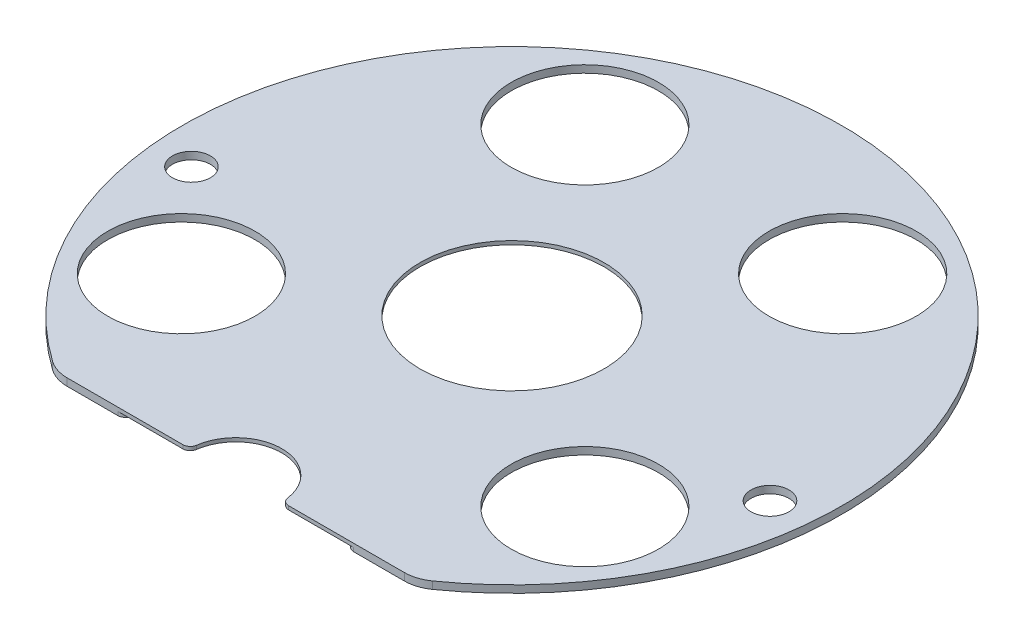
from build123d import *

# Parameters (mm, degrees)
BOSS_EXTRUDE1_DEPTH = 2
SKETCH9_R           = 5.15
CUT_EXTRUDE3_DEPTH  = 127.587914115
VISION_PATTERN_R    = 25
VISION_PATTERN_R_2  = 20
CUT_EXTRUDE4_DEPTH  = 127.587914115
FILLET1_R           = 10
BOSS_EXTRUDE4_DEPTH = 50
SKETCH12_W          = 60
SKETCH12_H          = 106
CUT_EXTRUDE5_DEPTH  = 1
SKETCH16_R          = 12.5
CUT_EXTRUDE9_DEPTH  = 20
SKETCH17_R          = 0.75
BOSS_EXTRUDE3_DEPTH = 0.425
CHAMFER1_SIZE       = 1.8
CHAMFER1_SIZE_2     = 3.860112457
CHAMFER2_SIZE       = 0.987120775
CHAMFER2_SIZE_2     = 1
FILLET3_R           = 0.1
FILLET2_R           = 0.4
FILLET4_R           = 5
FILLET5_R           = 2


with BuildPart() as part:
    # Sketch1 → Boss-Extrude1 (new body)
    with BuildSketch(Plane(origin=(0, 0, 0), x_dir=(1, 0, 0), z_dir=(0, 1, 0))):
        with BuildLine():
            Line((-48.839021284, -75), (48.839021284, -75))
            ThreePointArc((48.839021284, -75), (0, 89.5), (-48.839021284, -75))
        make_face()
    extrude(amount=-BOSS_EXTRUDE1_DEPTH)

    # Sketch9 → Cut-Extrude3 (cut, through all)
    with BuildSketch(Plane(origin=(0, 0, 0), x_dir=(1, 0, 0), z_dir=(0, 1, 0))):
        with Locations(Location((78.541209232, -8.501673503, 0), (0, 0, 270))):
            Circle(SKETCH9_R)
        with Locations(Location((-78.541209232, -8.501673503, 0), (0, 0, 270))):
            Circle(SKETCH9_R)
    extrude(amount=-CUT_EXTRUDE3_DEPTH, mode=Mode.SUBTRACT)

    # Vision Pattern → Cut-Extrude4 (cut, through all)
    with BuildSketch(Plane(origin=(0, 0, 0), x_dir=(1, 0, 0), z_dir=(0, 1, 0))):
        with Locations(Location((0, 0, 0), (0, 0, 270))):
            Circle(VISION_PATTERN_R)
        with Locations(Location((54.772255751, -35, 0), (0, 0, 270))):
            Circle(VISION_PATTERN_R_2)
        with Locations(Location((-54.772255751, -35, 0), (0, 0, 270))):
            Circle(VISION_PATTERN_R_2)
        with Locations(Location((35, 54.772255751, 0), (0, 0, 270))):
            Circle(VISION_PATTERN_R_2)
        with Locations(Location((-35, 54.772255751, 0), (0, 0, 270))):
            Circle(VISION_PATTERN_R_2)
    extrude(amount=-CUT_EXTRUDE4_DEPTH, mode=Mode.SUBTRACT)

    # Fillet1
    fillet1_edges = [part.edges().sort_by_distance(p)[0] for p in [
        (48.839021284, -1, 75),
        (-48.839021284, -1, 75),
    ]]
    fillet(fillet1_edges, radius=FILLET1_R)

    # Sketch18 → Boss-Extrude4 (add)
    with BuildSketch(Plane.XY.offset(5)):
        Polygon((62.854667939, -3.6), (67.145332061, -3.6), (66.025, -2), (63.975, -2), align=None)
    boss_extrude4 = extrude(amount=-BOSS_EXTRUDE4_DEPTH)

    # Mirror2: Boss-Extrude4 across plane
    add(boss_extrude4.mirror(Plane(origin=(0, 0, 0), x_dir=(0, 0, 1), z_dir=(1, 0, 0))))

    # Sketch12 → Cut-Extrude5 (cut)
    with BuildSketch(Plane.XZ.offset(2)):
        with Locations((0, 22)):
            Rectangle(SKETCH12_W, SKETCH12_H)
    extrude(amount=-CUT_EXTRUDE5_DEPTH, mode=Mode.SUBTRACT)

    # Sketch16 → Cut-Extrude9 (cut)
    with BuildSketch(Plane(origin=(0, 0, 0), x_dir=(1, 0, 0), z_dir=(0, 1, 0))):
        with Locations((0, -75)):
            Circle(SKETCH16_R)
    extrude(amount=-CUT_EXTRUDE9_DEPTH, mode=Mode.SUBTRACT)

    # Sketch17 → Boss-Extrude3 (add)
    with BuildSketch(Plane.XZ.offset(1)):
        with Locations(Location((-22, -25, 0), (0, 0, 270))):
            Circle(SKETCH17_R)
    boss_extrude3 = extrude(amount=BOSS_EXTRUDE3_DEPTH)

    # Mirror1: Boss-Extrude3 across plane
    add(boss_extrude3.mirror(Plane(origin=(0, 0, 0), x_dir=(0, 0, 1), z_dir=(1, 0, 0))))

    # Chamfer1
    # the kernel refuses this chamfer: 3.860112457, 1.8 mm, written as the material it takes off along each edge
    with BuildSketch(Plane(origin=(52.853211246, -3.6, -45), x_dir=(0, 0.9971975577536774, -0.07481330637060049), z_dir=(1, 0, 0))) as chamfer1_piece_1_section:
        Polygon((CHAMFER1_SIZE * 0.997197557754, CHAMFER1_SIZE * 0.0748133063706), (-CHAMFER1_SIZE_2 * 0.074813306369, CHAMFER1_SIZE_2 * 0.997197557732), (0, 0), align=None)
    chamfer1_piece_1 = extrude(amount=24.293577508, mode=Mode.PRIVATE)
    chamfer1_piece_1 = split(chamfer1_piece_1, bisect_by=Plane(origin=(65, -2, -43.665311996), z_dir=(0, -1, 0)), keep=Keep.TOP, mode=Mode.PRIVATE)
    add(chamfer1_piece_1, mode=Mode.SUBTRACT)
    with BuildSketch(Plane(origin=(52.853211246, -3.6, 5), x_dir=(0, 0.9971975577536774, 0.07481330637060049), z_dir=(1, 0, 0))) as chamfer1_piece_2_section:
        Polygon((CHAMFER1_SIZE * 0.997197557754, -CHAMFER1_SIZE * 0.0748133063706), (-CHAMFER1_SIZE_2 * 0.074813306369, -CHAMFER1_SIZE_2 * 0.997197557732), (0, 0), align=None)
    chamfer1_piece_2 = extrude(amount=24.293577508, mode=Mode.PRIVATE)
    chamfer1_piece_2 = split(chamfer1_piece_2, bisect_by=Plane(origin=(65, -2, 3.665311996), z_dir=(0, -1, 0)), keep=Keep.TOP, mode=Mode.PRIVATE)
    add(chamfer1_piece_2, mode=Mode.SUBTRACT)
    with BuildSketch(Plane(origin=(-52.853211246, -3.6, 5), x_dir=(0, 0.9971975577536774, 0.07481330637060049), z_dir=(-1, 0, 0))) as chamfer1_piece_3_section:
        Polygon((CHAMFER1_SIZE * 0.997197557754, CHAMFER1_SIZE * 0.0748133063706), (-CHAMFER1_SIZE_2 * 0.074813306369, CHAMFER1_SIZE_2 * 0.997197557732), (0, 0), align=None)
    chamfer1_piece_3 = extrude(amount=24.293577508, mode=Mode.PRIVATE)
    chamfer1_piece_3 = split(chamfer1_piece_3, bisect_by=Plane(origin=(-65, -2, 3.665311996), z_dir=(0, -1, 0)), keep=Keep.TOP, mode=Mode.PRIVATE)
    add(chamfer1_piece_3, mode=Mode.SUBTRACT)
    with BuildSketch(Plane(origin=(-52.853211246, -3.6, -45), x_dir=(0, 0.9971975577536774, -0.07481330637060049), z_dir=(-1, 0, 0))) as chamfer1_piece_4_section:
        Polygon((CHAMFER1_SIZE * 0.997197557754, -CHAMFER1_SIZE * 0.0748133063706), (-CHAMFER1_SIZE_2 * 0.074813306369, -CHAMFER1_SIZE_2 * 0.997197557732), (0, 0), align=None)
    chamfer1_piece_4 = extrude(amount=24.293577508, mode=Mode.PRIVATE)
    chamfer1_piece_4 = split(chamfer1_piece_4, bisect_by=Plane(origin=(-65, -2, -43.665311996), z_dir=(0, -1, 0)), keep=Keep.TOP, mode=Mode.PRIVATE)
    add(chamfer1_piece_4, mode=Mode.SUBTRACT)

    # Chamfer2
    # the kernel refuses this chamfer: 1, 0.987120775 mm, written as the material it takes off along each edge
    with BuildSketch(Plane(origin=(-65.301002381, -0.966024243, 6.788466782), x_dir=(0.4696180134880429, 0.7314458045546072, -0.49441476151810837), z_dir=(-0.2837570390591316, -0.4052470497313357, -0.8690551026652124))) as chamfer2_piece_1_section:
        Polygon((CHAMFER2_SIZE * 0.999392501434, CHAMFER2_SIZE * 0.0348515221858), (CHAMFER2_SIZE_2 * 0.489748534071, CHAMFER2_SIZE_2 * 0.871863735555), (0, 0), align=None)
    chamfer2_piece_1 = extrude(amount=9.051149208, mode=Mode.PRIVATE)
    chamfer2_piece_1 = split(chamfer2_piece_1, bisect_by=Plane(origin=(-66.526786639, -2, 1.318548556), z_dir=(0, -1, 0)), keep=Keep.TOP, mode=Mode.PRIVATE)
    add(chamfer2_piece_1, mode=Mode.SUBTRACT)
    with BuildSketch(Plane(origin=(-62.13067032, -4.633975757, -1.077480623), x_dir=(-0.46961801348803994, 0.73144580455461, -0.49441476151810687), z_dir=(-0.28375703905912847, 0.40524704973133613, 0.8690551026652132))) as chamfer2_piece_2_section:
        Polygon((CHAMFER2_SIZE * 0.999392501434, CHAMFER2_SIZE * 0.0348515221858), (CHAMFER2_SIZE_2 * 0.489748534071, CHAMFER2_SIZE_2 * 0.871863735555), (0, 0), align=None)
    chamfer2_piece_2 = extrude(amount=9.051149208, mode=Mode.PRIVATE)
    chamfer2_piece_2 = split(chamfer2_piece_2, bisect_by=Plane(origin=(-63.473213361, -2, 1.318548556), z_dir=(0, -1, 0)), keep=Keep.TOP, mode=Mode.PRIVATE)
    add(chamfer2_piece_2, mode=Mode.SUBTRACT)
    with BuildSketch(Plane(origin=(64.698997619, -0.966024243, 6.788466782), x_dir=(0.9583436918926346, -0.15061389857445218, -0.24267843284024973), z_dir=(-0.28375703905912847, -0.40524704973133613, -0.8690551026652132))) as chamfer2_piece_3_section:
        Polygon((CHAMFER2_SIZE_2 * 0.999423797129, -CHAMFER2_SIZE_2 * 0.0339422116651), (CHAMFER2_SIZE * 0.490541595675, -CHAMFER2_SIZE * 0.871417777782), (0, 0), align=None)
    chamfer2_piece_3 = extrude(amount=9.051149208, mode=Mode.PRIVATE)
    chamfer2_piece_3 = split(chamfer2_piece_3, bisect_by=Plane(origin=(63.473213361, -2, 1.318548556), z_dir=(0, -1, 0)), keep=Keep.TOP, mode=Mode.PRIVATE)
    add(chamfer2_piece_3, mode=Mode.SUBTRACT)
    with BuildSketch(Plane(origin=(67.86932968, -4.633975757, -1.077480623), x_dir=(-0.46961801348803955, 0.7314458045546093, -0.4944147615181082), z_dir=(-0.2837570390591316, 0.4052470497313357, 0.8690551026652124))) as chamfer2_piece_4_section:
        Polygon((CHAMFER2_SIZE * 0.999392501434, CHAMFER2_SIZE * 0.0348515221858), (CHAMFER2_SIZE_2 * 0.489748534071, CHAMFER2_SIZE_2 * 0.871863735555), (0, 0), align=None)
    chamfer2_piece_4 = extrude(amount=9.051149208, mode=Mode.PRIVATE)
    chamfer2_piece_4 = split(chamfer2_piece_4, bisect_by=Plane(origin=(66.526786639, -2, 1.318548556), z_dir=(0, -1, 0)), keep=Keep.TOP, mode=Mode.PRIVATE)
    add(chamfer2_piece_4, mode=Mode.SUBTRACT)
    with BuildSketch(Plane(origin=(-65.301002381, -0.966024243, -46.788466782), x_dir=(0.46961801348803894, 0.7314458045546097, 0.49441476151810826), z_dir=(-0.2837570390591316, -0.4052470497313357, 0.8690551026652124))) as chamfer2_piece_5_section:
        Polygon((CHAMFER2_SIZE * 0.999392501434, -CHAMFER2_SIZE * 0.0348515221858), (CHAMFER2_SIZE_2 * 0.489748534071, -CHAMFER2_SIZE_2 * 0.871863735555), (0, 0), align=None)
    chamfer2_piece_5 = extrude(amount=9.051149208, mode=Mode.PRIVATE)
    chamfer2_piece_5 = split(chamfer2_piece_5, bisect_by=Plane(origin=(-66.526786639, -2, -41.318548556), z_dir=(0, -1, 0)), keep=Keep.TOP, mode=Mode.PRIVATE)
    add(chamfer2_piece_5, mode=Mode.SUBTRACT)
    with BuildSketch(Plane(origin=(-62.13067032, -4.633975757, -38.922519377), x_dir=(-0.46961801348803905, 0.7314458045546104, 0.49441476151810687), z_dir=(-0.28375703905912847, 0.40524704973133613, -0.8690551026652132))) as chamfer2_piece_6_section:
        Polygon((CHAMFER2_SIZE * 0.999392501434, -CHAMFER2_SIZE * 0.0348515221858), (CHAMFER2_SIZE_2 * 0.489748534071, -CHAMFER2_SIZE_2 * 0.871863735555), (0, 0), align=None)
    chamfer2_piece_6 = extrude(amount=9.051149208, mode=Mode.PRIVATE)
    chamfer2_piece_6 = split(chamfer2_piece_6, bisect_by=Plane(origin=(-63.473213361, -2, -41.318548556), z_dir=(0, -1, 0)), keep=Keep.TOP, mode=Mode.PRIVATE)
    add(chamfer2_piece_6, mode=Mode.SUBTRACT)
    with BuildSketch(Plane(origin=(64.698997619, -0.966024243, -46.788466782), x_dir=(0.9583436918926347, -0.150613898574452, 0.24267843284024984), z_dir=(-0.28375703905912847, -0.40524704973133613, 0.8690551026652132))) as chamfer2_piece_7_section:
        Polygon((CHAMFER2_SIZE_2 * 0.999423797129, CHAMFER2_SIZE_2 * 0.0339422116651), (CHAMFER2_SIZE * 0.490541595675, CHAMFER2_SIZE * 0.871417777782), (0, 0), align=None)
    chamfer2_piece_7 = extrude(amount=9.051149208, mode=Mode.PRIVATE)
    chamfer2_piece_7 = split(chamfer2_piece_7, bisect_by=Plane(origin=(63.473213361, -2, -41.318548556), z_dir=(0, -1, 0)), keep=Keep.TOP, mode=Mode.PRIVATE)
    add(chamfer2_piece_7, mode=Mode.SUBTRACT)
    with BuildSketch(Plane(origin=(67.86932968, -4.633975757, -38.922519377), x_dir=(-0.46961801348803994, 0.731445804554609, 0.49441476151810815), z_dir=(-0.2837570390591316, 0.4052470497313357, -0.8690551026652124))) as chamfer2_piece_8_section:
        Polygon((CHAMFER2_SIZE * 0.999392501434, -CHAMFER2_SIZE * 0.0348515221858), (CHAMFER2_SIZE_2 * 0.489748534071, -CHAMFER2_SIZE_2 * 0.871863735555), (0, 0), align=None)
    chamfer2_piece_8 = extrude(amount=9.051149208, mode=Mode.PRIVATE)
    chamfer2_piece_8 = split(chamfer2_piece_8, bisect_by=Plane(origin=(66.526786639, -2, -41.318548556), z_dir=(0, -1, 0)), keep=Keep.TOP, mode=Mode.PRIVATE)
    add(chamfer2_piece_8, mode=Mode.SUBTRACT)

    # Fillet3
    fillet3_edges = [part.edges().sort_by_distance(p)[0] for p in [
        (-67.145332061, -3.6, -20),
        (-65, -3.6, -41.139887543),
        (-62.854667939, -3.6, -20),
        (-65, -3.6, 1.139887543),
        (-63.376100806, -3.6, 0.142222043),
        (-66.623899194, -3.6, 0.142222043),
        (-63.376100806, -3.6, -40.142222043),
        (-66.623899194, -3.6, -40.142222043),
        (62.854667939, -3.6, -20),
        (65, -3.6, -41.139887543),
        (67.145332061, -3.6, -20),
        (65, -3.6, 1.139887543),
        (66.623899194, -3.6, 0.142222043),
        (63.376100806, -3.6, 0.142222043),
        (66.623899194, -3.6, -40.142222043),
        (63.376100806, -3.6, -40.142222043),
    ]]
    fillet(fillet3_edges, radius=FILLET3_R)

    # Fillet2
    fillet2_edges = [part.edges().sort_by_distance(p)[0] for p in [
        (-22, -1.425, -24.25),
        (22, -1.425, -24.25),
    ]]
    fillet(fillet2_edges, radius=FILLET2_R)

    # Fillet4
    fillet4_edges = [part.edges().sort_by_distance(p)[0] for p in [
        (-30, -1.5, -31),
        (30, -1.5, -31),
    ]]
    fillet(fillet4_edges, radius=FILLET4_R)

    # Fillet5
    fillet5_edges = [part.edges().sort_by_distance(p)[0] for p in [
        (-12.5, -0.5, 75),
        (-30, -1.5, 75),
        (30, -1.5, 75),
        (12.5, -0.5, 75),
    ]]
    fillet(fillet5_edges, radius=FILLET5_R)


solid = part.part
